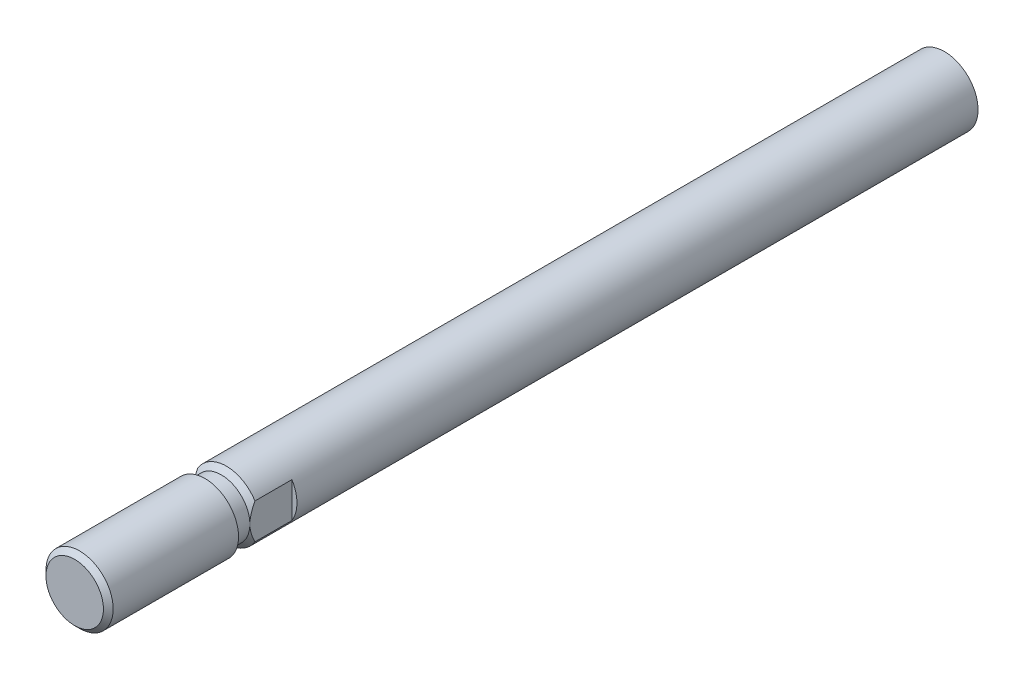
from build123d import *

# Parameters (mm, degrees)
EXTRUDE_START        = 79.5
SKETCH_4_R           = 4
EXTRUDE_1_DEPTH      = 15.5
SKETCH_5_R           = 3.4
EXTRUDE_2_DEPTH      = 1.95
SKETCH_6_R           = 4
EXTRUDE_3_DEPTH      = 86.05
CHAMFER_1_SIZE       = 0.58
CHAMFER_2_SIZE       = 0.6
CUT_EXTRUDE_START    = 57.05
SKETCH_9_OUTSIDE_W   = 30.824
SKETCH_9_OUTSIDE_H   = 30.824
SKETCH_9_OUTSIDE_W_2 = 6.8
SKETCH_9_OUTSIDE_H_2 = 15.011106998
CUT_EXTRUDE_1_DEPTH  = 5


with BuildPart() as part:
    # 草图4 → 凸台-拉伸1 (new body)
    with BuildSketch(Plane.XY.offset(EXTRUDE_START)):
        Circle(SKETCH_4_R)
    extrude(amount=-EXTRUDE_1_DEPTH)

    # 草图5 → 凸台-拉伸2 (add)
    with BuildSketch(Plane(origin=(0, 0, 64), x_dir=(-1, 0, 0), z_dir=(0, 0, -1))):
        with Locations(Location((0, 0, 0), (0, 0, 180))):
            Circle(SKETCH_5_R)
    extrude(amount=EXTRUDE_2_DEPTH)

    # 草图6 → 凸台-拉伸3 (add)
    with BuildSketch(Plane(origin=(0, 0, 62.05), x_dir=(-1, 0, 0), z_dir=(0, 0, -1))):
        with Locations(Location((0, 0, 0), (0, 0, 180))):
            Circle(SKETCH_6_R)
    extrude(amount=EXTRUDE_3_DEPTH)

    # 倒角1
    chamfer_1_edges = [part.edges().sort_by_distance(p)[0] for p in [
        (-4, 0, 79.5),
    ]]
    chamfer(chamfer_1_edges, length=CHAMFER_1_SIZE)

    # 倒角2
    chamfer_2_edges = [part.edges().sort_by_distance(p)[0] for p in [
        (-4, 0, 62.05),
    ]]
    chamfer(chamfer_2_edges, length=CHAMFER_2_SIZE - 0.0001)  # a hair under: the kernel refuses the full size

    # 草图9 outside → 切除-拉伸1 (cut)
    with BuildSketch(Plane.XY.offset(CUT_EXTRUDE_START)):
        Rectangle(SKETCH_9_OUTSIDE_W, SKETCH_9_OUTSIDE_H)
        Rectangle(SKETCH_9_OUTSIDE_W_2, SKETCH_9_OUTSIDE_H_2, mode=Mode.SUBTRACT)
    extrude(amount=CUT_EXTRUDE_1_DEPTH, mode=Mode.SUBTRACT)


solid = part.part
